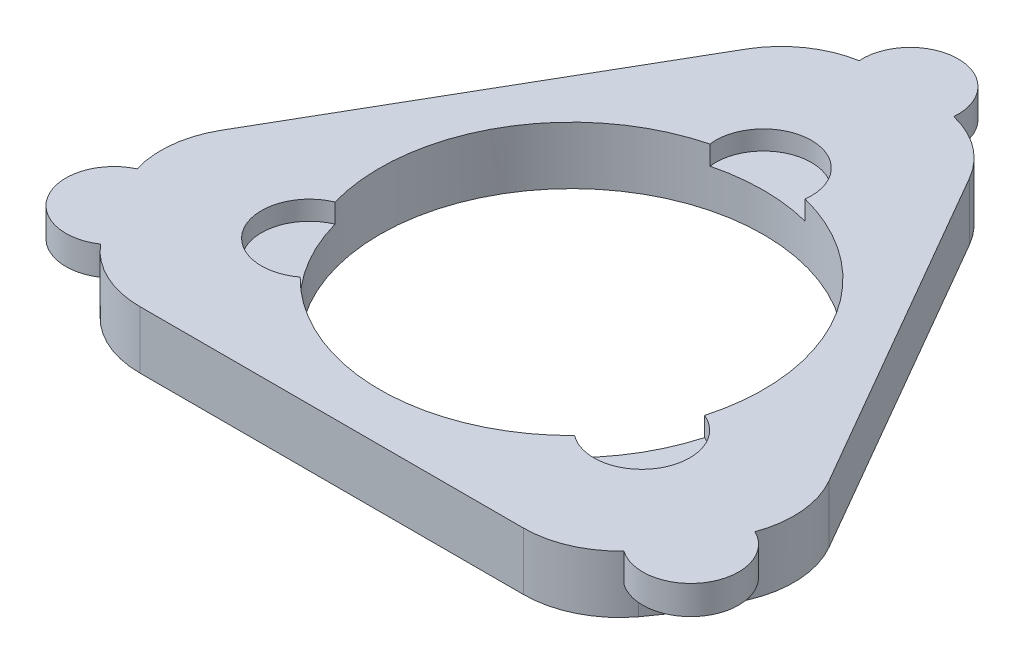
from build123d import *

# Parameters (mm, degrees)
SKETCH1_R                = 20
BOSS_EXTRUDE1_DEPTH      = 3.5
SKETCH2_R                = 35
SKETCH2_R_2              = 20
SKETCH2_R_3              = 2.8
BOSS_EXTRUDE2_DEPTH      = 6
BOSS_EXTRUDE3_DEPTH      = 2
BOSS_EXTRUDE3_DEPTH_BACK = 6
SKETCH4_R                = 2.9
SKETCH5_R                = 5
BOSS_EXTRUDE4_DEPTH      = 3
CUT_EXTRUDE1_START       = -10
SKETCH3_R                = 20
CUT_EXTRUDE1_DEPTH       = 10
SKETCH12_R               = 72.135852014
CUT_EXTRUDE2_DEPTH       = 22
FILLET1_R                = 10
CUT_EXTRUDE4_START       = -2
SKETCH15_R               = 5
SKETCH15_R_2             = 20
CUT_EXTRUDE4_DEPTH       = 2


with BuildPart() as part:
    # Sketch1 → Boss-Extrude1 (new body)
    with BuildSketch(Plane(origin=(0, 0, 0), x_dir=(1, 0, 0), z_dir=(0, 1, 0))):
        with Locations(Location((0, 0, 0), (0, 0, 270))):
            Circle(SKETCH1_R)
    extrude(amount=BOSS_EXTRUDE1_DEPTH)

    # Sketch2 → Boss-Extrude2 (add)
    with BuildSketch(Plane(origin=(0, 0, 0), x_dir=(1, 0, 0), z_dir=(0, 1, 0))):
        with Locations(Location((0, 0, 0), (0, 0, 270))):
            Circle(SKETCH2_R)
        with Locations(Location((0, 0, 0), (0, 0, 270))):
            Circle(SKETCH2_R_2, mode=Mode.SUBTRACT)
        with Locations(Location((0, 28.3, 0), (0, 0, 270))):
            Circle(SKETCH2_R_3, mode=Mode.SUBTRACT)
        with Locations(Location((24.508518927, -14.15, 0), (0, 0, 270))):
            Circle(SKETCH2_R_3, mode=Mode.SUBTRACT)
        with Locations(Location((-24.508518927, -14.15, 0), (0, 0, 270))):
            Circle(SKETCH2_R_3, mode=Mode.SUBTRACT)
    extrude(amount=BOSS_EXTRUDE2_DEPTH)

    # Sketch4 → Boss-Extrude3 (add, two sides: drawn at the far end of the back side and taken through both)
    with BuildSketch(Plane.XZ.offset(-BOSS_EXTRUDE3_DEPTH_BACK)):
        with Locations(Location((-24.508518927, 14.15, 0), (0, 0, 270))):
            Circle(SKETCH4_R)
        with Locations(Location((24.508518927, 14.15, 0), (0, 0, 270))):
            Circle(SKETCH4_R)
        with Locations(Location((0, -28.3, 0), (0, 0, 270))):
            Circle(SKETCH4_R)
    extrude(amount=BOSS_EXTRUDE3_DEPTH + BOSS_EXTRUDE3_DEPTH_BACK)

    # Sketch5 → Boss-Extrude4 (add)
    with BuildSketch(Plane(origin=(0, 6, 0), x_dir=(1, 0, 0), z_dir=(0, 1, 0))):
        with Locations((-30.453629482, -17.250404383)):
            Circle(SKETCH5_R)
        with Locations((0.28752632, 34.99881896)):
            Circle(SKETCH5_R)
        with Locations((30.166103162, -17.748414577)):
            Circle(SKETCH5_R)
    extrude(amount=-BOSS_EXTRUDE4_DEPTH)

    # Sketch3 → Cut-Extrude1 (cut)
    with BuildSketch(Plane(origin=(0, 3.5, 0), x_dir=(1, 0, 0), z_dir=(0, 1, 0)).offset(CUT_EXTRUDE1_START)):
        with Locations(Location((0, 0, 0), (0, 0, 270))):
            Circle(SKETCH3_R)
    extrude(amount=CUT_EXTRUDE1_DEPTH, mode=Mode.SUBTRACT)

    # Sketch12 → Cut-Extrude2 (cut)
    with BuildSketch(Plane(origin=(0, 6, 0), x_dir=(1, 0, 0), z_dir=(0, 1, 0))):
        Circle(SKETCH12_R)
        Polygon((0, 50), (-43.301270189, -25), (43.301270189, -25), align=None, mode=Mode.SUBTRACT)
    extrude(amount=-CUT_EXTRUDE2_DEPTH, mode=Mode.SUBTRACT)

    # Fillet1
    # the kernel refuses this fillet: 10 mm, written as the material it takes off along each edge
    with BuildSketch(Plane(origin=(-24.494897428, 19.2960859, 25), x_dir=(1, 0, 0), z_dir=(0, -1, 0))) as fillet1_piece_1_section:
        with BuildLine():
            CenterArc((4.494897428, -10), FILLET1_R, 90, 53.130102354)
            ThreePointArc((-3.505102572, -4), (-1.828638885, -1.933326291), (0, 0))
            Line((0, 0), (4.494897428, 0))
        make_face()
    fillet1_piece_1 = extrude(amount=32.5921718, mode=Mode.PRIVATE)
    fillet1_piece_1 = fillet1_piece_1 - Plane(origin=(-30.453629482, 4.5, 17.250404383), x_dir=(1, 0, 0), z_dir=(0, 1, 0)) * Cylinder(5, 84, mode=Mode.PRIVATE)
    add(fillet1_piece_1, mode=Mode.SUBTRACT)
    with BuildSketch(Plane(origin=(-24.494897428, 19.2960859, 25), x_dir=(1, 0, 0), z_dir=(0, -1, 0))) as fillet1_piece_2_section:
        with BuildLine():
            CenterArc((4.494897428, -10), FILLET1_R, 90, 53.130102354)
            ThreePointArc((-3.505102572, -4), (-1.828638885, -1.933326291), (0, 0))
            Line((0, 0), (4.494897428, 0))
        make_face()
    fillet1_piece_2 = extrude(amount=32.5921718, mode=Mode.PRIVATE)
    fillet1_piece_2 = split(fillet1_piece_2, bisect_by=Plane(origin=(-27.761621835, 3, 21.309124186), z_dir=(0, -1, 0)), keep=Keep.TOP, mode=Mode.PRIVATE)
    add(fillet1_piece_2, mode=Mode.SUBTRACT)
    with BuildSketch(Plane(origin=(24.494897428, 19.2960859, 25), x_dir=(-1, 0, 0), z_dir=(0, -1, 0))) as fillet1_piece_3_section:
        with BuildLine():
            CenterArc((4.494897428, 10), FILLET1_R, 216.869897646, 53.130102354)
            ThreePointArc((-3.505102572, 4), (-1.828638885, 1.933326291), (0, 0))
            Line((0, 0), (4.494897428, 0))
        make_face()
    fillet1_piece_3 = extrude(amount=32.5921718, mode=Mode.PRIVATE)
    fillet1_piece_3 = fillet1_piece_3 - Plane(origin=(30.166103162, 4.5, 17.748414577), x_dir=(1, 0, 0), z_dir=(0, 1, 0)) * Cylinder(5, 84, mode=Mode.PRIVATE)
    add(fillet1_piece_3, mode=Mode.SUBTRACT)
    with BuildSketch(Plane(origin=(24.494897428, 19.2960859, 25), x_dir=(-1, 0, 0), z_dir=(0, -1, 0))) as fillet1_piece_4_section:
        with BuildLine():
            CenterArc((4.494897428, 10), FILLET1_R, 216.869897646, 53.130102354)
            ThreePointArc((-3.505102572, 4), (-1.828638885, 1.933326291), (0, 0))
            Line((0, 0), (4.494897428, 0))
        make_face()
    fillet1_piece_4 = extrude(amount=32.5921718, mode=Mode.PRIVATE)
    fillet1_piece_4 = split(fillet1_piece_4, bisect_by=Plane(origin=(27.488157838, 3, 21.643747381), z_dir=(0, -1, 0)), keep=Keep.TOP, mode=Mode.PRIVATE)
    add(fillet1_piece_4, mode=Mode.SUBTRACT)
    with BuildSketch(Plane(origin=(-9.403186381, 19.2960859, -33.713203436), x_dir=(-0.5000000000000003, 0, 0.8660254037844386), z_dir=(0, -1, 0))) as fillet1_piece_5_section:
        with BuildLine():
            CenterArc((4.494897428, -10), FILLET1_R, 90, 53.130102354)
            ThreePointArc((-3.505102572, -4), (-1.828638885, -1.933326291), (0, 0))
            Line((0, 0), (4.494897428, 0))
        make_face()
    fillet1_piece_5 = extrude(amount=32.5921718, mode=Mode.PRIVATE)
    fillet1_piece_5 = fillet1_piece_5 - Plane(origin=(0.28752632, 4.5, -34.99881896), x_dir=(1, 0, 0), z_dir=(0, 1, 0)) * Cylinder(5, 84, mode=Mode.PRIVATE)
    add(fillet1_piece_5, mode=Mode.SUBTRACT)
    with BuildSketch(Plane(origin=(-9.403186381, 19.2960859, -33.713203436), x_dir=(-0.5000000000000003, 0, 0.8660254037844386), z_dir=(0, -1, 0))) as fillet1_piece_6_section:
        with BuildLine():
            CenterArc((4.494897428, -10), FILLET1_R, 90, 53.130102354)
            ThreePointArc((-3.505102572, -4), (-1.828638885, -1.933326291), (0, 0))
            Line((0, 0), (4.494897428, 0))
        make_face()
    fillet1_piece_6 = extrude(amount=32.5921718, mode=Mode.PRIVATE)
    fillet1_piece_6 = split(fillet1_piece_6, bisect_by=Plane(origin=(-4.57343196, 3, -34.696831852), z_dir=(0, -1, 0)), keep=Keep.TOP, mode=Mode.PRIVATE)
    add(fillet1_piece_6, mode=Mode.SUBTRACT)
    with BuildSketch(Plane(origin=(-33.898083809, 19.2960859, 8.713203436), x_dir=(0.32181469455231854, 0, 0.9468026734067654), z_dir=(0, -1, 0))) as fillet1_piece_7_section:
        with BuildLine():
            CenterArc((4.558658023, -9.971095222), FILLET1_R, 85.642603122, 53.130102354)
            Line((-2.962352352, -3.380617019), (0, 0))
            ThreePointArc((0, 0), (2.65921718, 0.101166725), (5.31843436, 0))
        make_face()
    fillet1_piece_7 = extrude(amount=32.5921718, mode=Mode.PRIVATE)
    fillet1_piece_7 = fillet1_piece_7 - Plane(origin=(-30.453629482, 4.5, 17.250404383), x_dir=(1, 0, 0), z_dir=(0, 1, 0)) * Cylinder(5, 87, mode=Mode.PRIVATE)
    add(fillet1_piece_7, mode=Mode.SUBTRACT)
    with BuildSketch(Plane(origin=(-33.898083809, 19.2960859, 8.713203436), x_dir=(0.32181469455231854, 0, 0.9468026734067654), z_dir=(0, -1, 0))) as fillet1_piece_8_section:
        with BuildLine():
            CenterArc((4.558658023, -9.971095222), FILLET1_R, 85.642603122, 53.130102354)
            Line((-2.962352352, -3.380617019), (0, 0))
            ThreePointArc((0, 0), (2.65921718, 0.101166725), (5.31843436, 0))
        make_face()
    fillet1_piece_8 = extrude(amount=32.5921718, mode=Mode.PRIVATE)
    fillet1_piece_8 = split(fillet1_piece_8, bisect_by=Plane(origin=(-32.488113984, 3, 12.9835693), z_dir=(0, -1, 0)), keep=Keep.TOP, mode=Mode.PRIVATE)
    add(fillet1_piece_8, mode=Mode.SUBTRACT)
    with BuildSketch(Plane(origin=(33.898083809, 19.2960859, 8.713203436), x_dir=(-0.5000000000000012, 0, -0.8660254037844382), z_dir=(0, -1, 0))) as fillet1_piece_9_section:
        with BuildLine():
            CenterArc((4.494897428, -10), FILLET1_R, 90, 53.130102354)
            ThreePointArc((-3.505102572, -4), (-1.828638885, -1.933326291), (0, 0))
            Line((0, 0), (4.494897428, 0))
        make_face()
    fillet1_piece_9 = extrude(amount=32.5921718, mode=Mode.PRIVATE)
    fillet1_piece_9 = fillet1_piece_9 - Plane(origin=(30.166103162, 4.5, 17.748414577), x_dir=(1, 0, 0), z_dir=(0, 1, 0)) * Cylinder(5, 84, mode=Mode.PRIVATE)
    add(fillet1_piece_9, mode=Mode.SUBTRACT)
    with BuildSketch(Plane(origin=(33.898083809, 19.2960859, 8.713203436), x_dir=(-0.5000000000000012, 0, -0.8660254037844382), z_dir=(0, -1, 0))) as fillet1_piece_10_section:
        with BuildLine():
            CenterArc((4.494897428, -10), FILLET1_R, 90, 53.130102354)
            ThreePointArc((-3.505102572, -4), (-1.828638885, -1.933326291), (0, 0))
            Line((0, 0), (4.494897428, 0))
        make_face()
    fillet1_piece_10 = extrude(amount=32.5921718, mode=Mode.PRIVATE)
    fillet1_piece_10 = split(fillet1_piece_10, bisect_by=Plane(origin=(32.335053795, 3, 13.387707666), z_dir=(0, -1, 0)), keep=Keep.TOP, mode=Mode.PRIVATE)
    add(fillet1_piece_10, mode=Mode.SUBTRACT)
    with BuildSketch(Plane(origin=(9.403186381, 19.2960859, -33.713203436), x_dir=(-0.9808625148174394, 0, -0.19470163590994477), z_dir=(0, -1, 0))) as fillet1_piece_11_section:
        with BuildLine():
            CenterArc((4.558658023, -9.971095222), FILLET1_R, 85.642603122, 53.130102354)
            Line((-2.962352352, -3.380617019), (0, 0))
            ThreePointArc((0, 0), (2.65921718, 0.101166725), (5.31843436, 0))
        make_face()
    fillet1_piece_11 = extrude(amount=32.5921718, mode=Mode.PRIVATE)
    fillet1_piece_11 = fillet1_piece_11 - Plane(origin=(0.28752632, 4.5, -34.99881896), x_dir=(1, 0, 0), z_dir=(0, 1, 0)) * Cylinder(5, 87, mode=Mode.PRIVATE)
    add(fillet1_piece_11, mode=Mode.SUBTRACT)
    with BuildSketch(Plane(origin=(9.403186381, 19.2960859, -33.713203436), x_dir=(-0.9808625148174394, 0, -0.19470163590994477), z_dir=(0, -1, 0))) as fillet1_piece_12_section:
        with BuildLine():
            CenterArc((4.558658023, -9.971095222), FILLET1_R, 85.642603122, 53.130102354)
            Line((-2.962352352, -3.380617019), (0, 0))
            ThreePointArc((0, 0), (2.65921718, 0.101166725), (5.31843436, 0))
        make_face()
    fillet1_piece_12 = extrude(amount=32.5921718, mode=Mode.PRIVATE)
    fillet1_piece_12 = split(fillet1_piece_12, bisect_by=Plane(origin=(4.999956146, 3, -34.627316681), z_dir=(0, -1, 0)), keep=Keep.TOP, mode=Mode.PRIVATE)
    add(fillet1_piece_12, mode=Mode.SUBTRACT)

    # Sketch15 → Cut-Extrude4 (cut)
    with BuildSketch(Plane(origin=(0, 6, 0), x_dir=(1, 0, 0), z_dir=(0, 1, 0)).offset(CUT_EXTRUDE4_START)):
        with Locations((0, 20)):
            Circle(SKETCH15_R)
        with Locations(Location((0, 0, 0), (0, 0, 104.361511563))):
            Circle(SKETCH15_R_2)
        with Locations((-17.320508076, -10)):
            Circle(SKETCH15_R)
        with Locations((17.320508076, -10)):
            Circle(SKETCH15_R)
    extrude(amount=CUT_EXTRUDE4_DEPTH, mode=Mode.SUBTRACT)


solid = part.part
